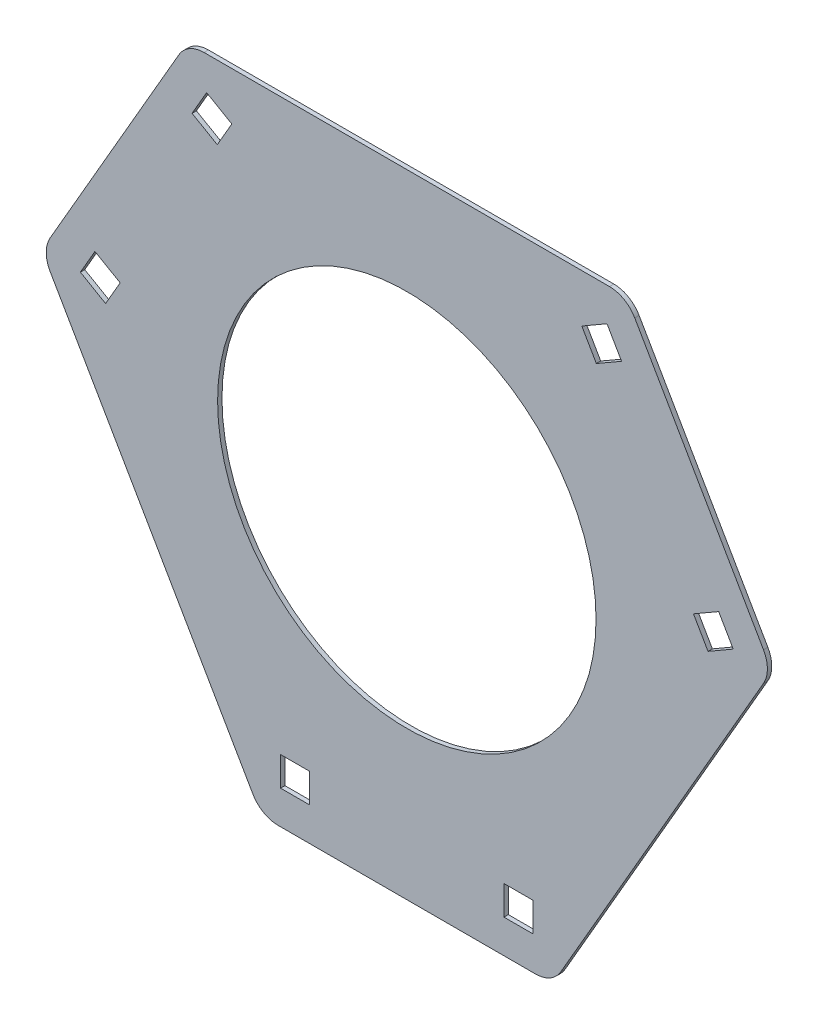
from build123d import *

# Parameters (mm, degrees)
SKETCH_1_R          = 130
EXTRUDE_1_DEPTH     = 3
SKETCH_8_W          = 20
SKETCH_8_H          = 20
CUT_EXTRUDE_4_DEPTH = 342.601434578
FILLET_2_R          = 20


with BuildPart() as part:
    # 草图1 → 凸台-拉伸1 (new body)
    with BuildSketch(Plane.XY):
        Polygon((250.820293595, 29.341110188), (150.820293595, 202.546190944), (-150.820293595, 202.546190944), (-250.820293595, 29.341110188), (-100, -231.887301132), (100, -231.887301132), align=None)
        Circle(SKETCH_1_R, mode=Mode.SUBTRACT)
    extrude(amount=EXTRUDE_1_DEPTH)

    # 草图8 → 切除-拉伸4 (cut, through all)
    with BuildSketch(Plane.XY.offset(3)):
        Polygon((-137.541237404, 179.546190944), (-147.541237404, 162.225682869), (-130.220729328, 152.225682869), (-120.220729328, 169.546190944), align=None)
        Polygon((-214.262181213, 46.661618263), (-224.262181213, 29.341110188), (-206.941673137, 19.341110188), (-196.941673137, 36.661618263), align=None)
        with Locations((-76.720943809, -198.887301132)):
            Rectangle(SKETCH_8_W, SKETCH_8_H)
        with Locations((76.720943809, -198.887301132)):
            Rectangle(SKETCH_8_W, SKETCH_8_H)
        Polygon((224.262181213, 29.341110188), (214.262181213, 46.661618263), (196.941673137, 36.661618263), (206.941673137, 19.341110188), align=None)
        Polygon((137.541237404, 179.546190944), (147.541237404, 162.225682869), (130.220729328, 152.225682869), (120.220729328, 169.546190944), align=None)
    extrude(amount=-CUT_EXTRUDE_4_DEPTH, mode=Mode.SUBTRACT)

    # 圆角2
    fillet_2_edges = [part.edges().sort_by_distance(p)[0] for p in [
        (100, -231.887301132, 1.5),
        (-100, -231.887301132, 1.5),
        (150.820293595, 202.546190944, 1.5),
        (250.820293595, 29.341110188, 1.5),
        (-250.820293595, 29.341110188, 1.5),
        (-150.820293595, 202.546190944, 1.5),
    ]]
    fillet(fillet_2_edges, radius=FILLET_2_R)


solid = part.part
